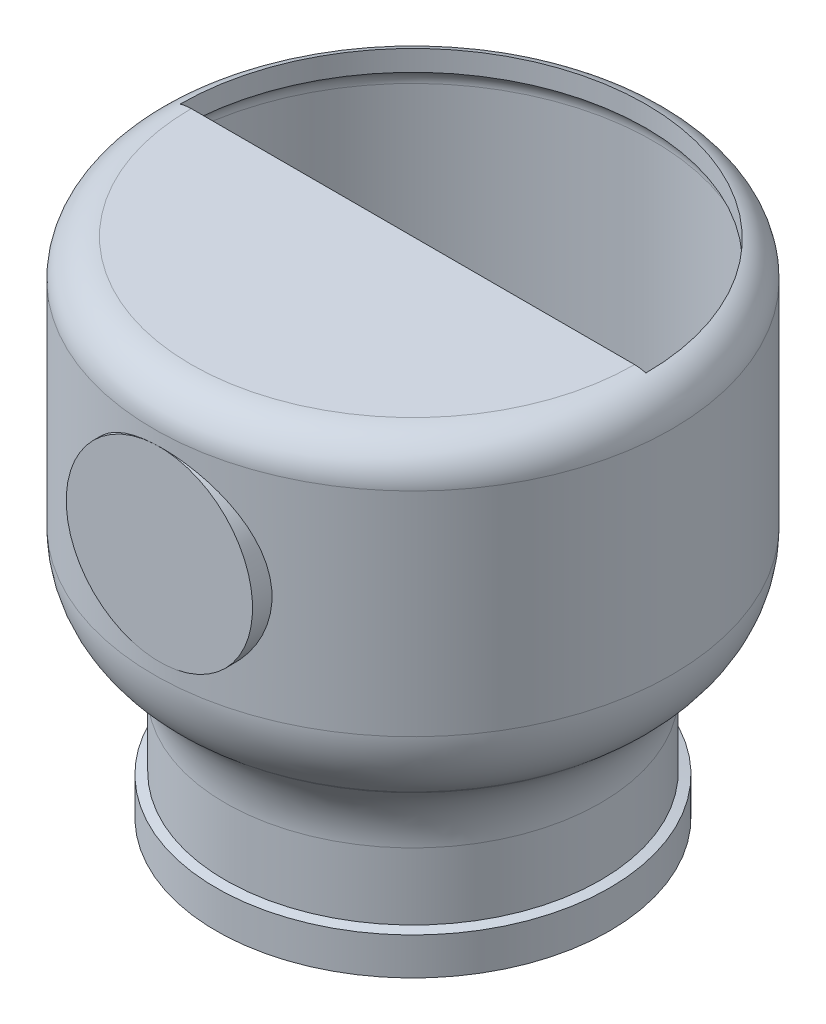
from build123d import *
from build123d.topology import SkipClean

# Parameters (mm, degrees)
CUT_EXTRUDE2_DEPTH      = 25
SKETCH10_R              = 10
BOSS_EXTRUDE1_DEPTH     = 5
CUT_EXTRUDE3_DEPTH      = 5
CUT_EXTRUDE3_DEPTH_BACK = 10


with BuildPart() as part:
    # Sketch1 → Revolve1 (revolve)
    with BuildSketch(Plane.XY):
        with BuildLine():
            Line((20.9, 0), (23.871591838, 0))
            Line((23.871591838, 0), (23.871591838, 4))
            Line((23.871591838, 4), (22.9, 4.236662843))
            Line((22.9, 4.236662843), (22.9, 11.404308102))
            ThreePointArc((22.9, 11.404308102), (23.83692213, 15.63049072), (26.472123903, 19.064752533))
            Line((26.472123903, 19.064752533), (26.988320528, 19.497892931))
            ThreePointArc((26.988320528, 19.497892931), (29.623522302, 22.932154745), (30.560444431, 27.158337362))
            Line((30.560444431, 27.158337362), (30.560444431, 50))
            ThreePointArc((30.560444431, 50), (29.388871556, 52.828427125), (26.560444431, 54))
            Line((26.560444431, 54), (2.764914955, 54))
            Line((2.764914955, 54), (2.764914955, 52))
            Line((2.764914955, 52), (26.560444431, 52))
            ThreePointArc((26.560444431, 52), (27.974657994, 51.414213562), (28.560444431, 50))
            Line((28.560444431, 50), (28.560444431, 28.090952678))
            ThreePointArc((28.560444431, 28.090952678), (27.623522302, 23.864770061), (24.988320528, 20.430508247))
            Line((24.988320528, 20.430508247), (23.688173754, 19.339555569))
            ThreePointArc((23.688173754, 19.339555569), (20.680499091, 17.603073792), (17.260297657, 17))
            Line((17.260297657, 17), (2.764914955, 17))
            Line((2.764914955, 17), (2.764914955, 15))
            Line((2.764914955, 15), (19.9, 15))
            ThreePointArc((19.9, 15), (20.607106781, 14.707106781), (20.9, 14))
            Line((20.9, 14), (20.9, 0))
        make_face()
    revolve(axis=Axis((2.764914955, 7.821821657, 0), (0, 1, 0)))

    # Sketch9 → Cut-Extrude2 (cut)
    with BuildSketch(Plane(origin=(0, 54, 0), x_dir=(1, 0, 0), z_dir=(0, 1, 0))):
        with BuildLine():
            Line((-22.235085045, 0), (27.764914955, 0))
            ThreePointArc((27.764914955, 0), (2.764914955, 25), (-22.235085045, 0))
        make_face()
    extrude(amount=-CUT_EXTRUDE2_DEPTH, mode=Mode.SUBTRACT)

    # Sketch10 → Boss-Extrude1 (add)
    with SkipClean():  # the faces are left unmerged after this step: merging them gives an invalid solid
        with BuildSketch(Plane.XY.offset(27.795529476)):
            with Locations((3.346345887, 38.658337362)):
                Circle(SKETCH10_R)
        extrude(amount=-BOSS_EXTRUDE1_DEPTH)

    # Sketch11 → Cut-Extrude3 (cut, two sides: drawn at the far end of the back side and taken through both)
    with SkipClean():  # the faces are left unmerged after this step: merging them gives an invalid solid
        with BuildSketch(Plane(origin=(0, 17, 0), x_dir=(1, 0, 0), z_dir=(0, 1, 0)).offset(-CUT_EXTRUDE3_DEPTH_BACK)):
            with BuildLine():
                Line((-14.735085045, 0), (20.264914955, 0))
                ThreePointArc((20.264914955, 0), (2.764914955, 17.5), (-14.735085045, 0))
            make_face()
        extrude(amount=CUT_EXTRUDE3_DEPTH + CUT_EXTRUDE3_DEPTH_BACK, mode=Mode.SUBTRACT)


solid = part.part
